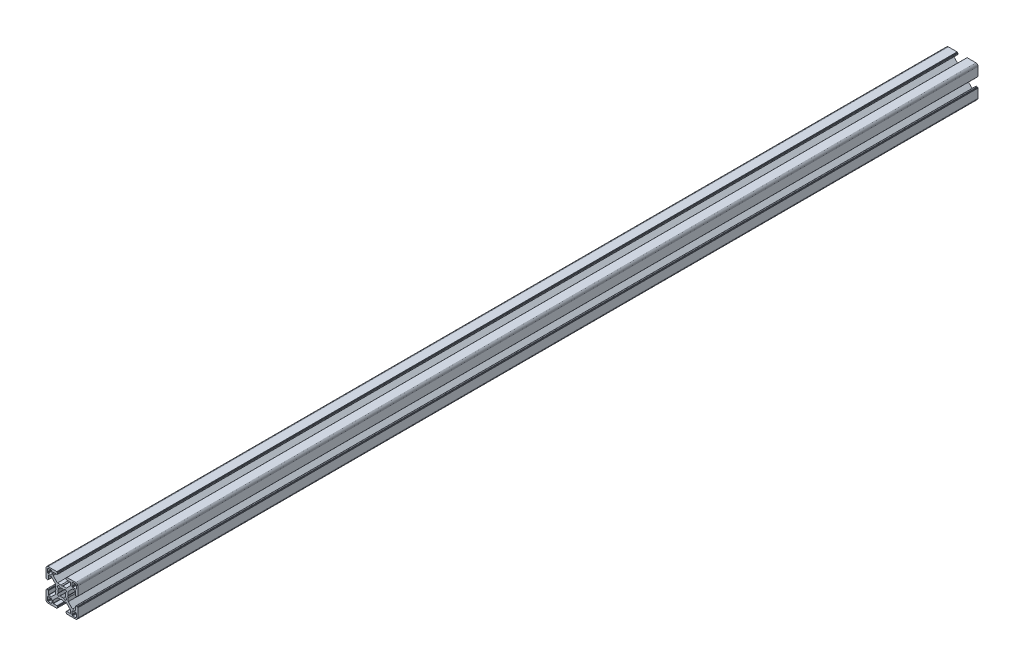
from build123d import *

# Parameters (mm, degrees)
BOSS_EXTRUDE1_DEPTH = 850


with BuildPart() as part:
    # Sketch1 → Boss-Extrude1 (new body)
    with BuildSketch(Plane.XY):
        Polygon((28.34729664, 29.969613999), (28.000000864, 29.999999329), (19.750000909, 29.999999329), (19.715268165, 29.996961355), (19.681595266, 29.987938702), (19.649999216, 29.973205179), (19.621443003, 29.953207821), (19.596790895, 29.928557575), (19.576793537, 29.899999499), (19.562061876, 29.868405312), (19.55303736, 29.834728688), (19.549999386, 29.799999669), (19.549999386, 29.699999839), (19.546961412, 29.665268958), (19.537936896, 29.631596059), (19.523203373, 29.599998146), (19.503207877, 29.571441934), (19.478557631, 29.546789825), (19.449999556, 29.526794329), (19.418403506, 29.512060806), (19.384728745, 29.503038153), (19.349999726, 29.500000179), (19.249999896, 29.500000179), (19.215267517, 29.496958527), (19.181592755, 29.487935874), (19.149996706, 29.47320235), (19.12143863, 29.453206855), (19.096788384, 29.428554746), (19.076791026, 29.399996671), (19.062057503, 29.368402484), (19.05303485, 29.334725859), (19.049996876, 29.299998703), (19.049996876, 28.39999837), (19.059110798, 28.29580945), (19.08618062, 28.194785165), (19.13038119, 28.099997016), (19.190369539, 28.014324653), (19.264324002, 27.94037019), (19.349996366, 27.88038184), (19.444784515, 27.836181271), (19.545806937, 27.809111449), (19.650010894, 27.799984574), (23.050010706, 27.799984574), (23.084741588, 27.7969466), (23.118414487, 27.787923946), (23.150012399, 27.773190423), (23.178568612, 27.753193065), (23.203220721, 27.728542819), (23.223218079, 27.699984744), (23.237949739, 27.668386831), (23.246974255, 27.634713932), (23.25001142, 27.59998608), (23.25001142, 25.049987618), (19.204474482, 20.999982084), (15.900007876, 20.999982084), (15.000008474, 20.48483404), (14.10000814, 20.999982084), (10.795543398, 20.999982084), (7.997342887, 23.801274731), (6.750011387, 25.049984589), (6.750011387, 27.599983051), (6.753049362, 27.634713932), (6.762072946, 27.668386831), (6.776805538, 27.699984744), (6.796801965, 27.728542819), (6.821454073, 27.753193065), (6.850011218, 27.773190423), (6.881607267, 27.787923946), (6.915282029, 27.7969466), (6.950011048, 27.799984574), (10.350011791, 27.799984574), (10.45420071, 27.809098497), (10.555223133, 27.836168318), (10.650011282, 27.880368888), (10.735683645, 27.940357238), (10.809638108, 28.014311701), (10.869626458, 28.099984064), (10.913827027, 28.194772213), (10.940895918, 28.295796498), (10.950010772, 28.399985417), (10.950010772, 29.299985751), (10.946974575, 29.334739239), (10.93795065, 29.368415522), (10.923215933, 29.400009153), (10.903218427, 29.428566473), (10.878566319, 29.45321765), (10.849999264, 29.473204166), (10.818403214, 29.487937689), (10.784728453, 29.496960342), (10.749999434, 29.500000179), (10.649999604, 29.500000179), (10.615270585, 29.503038153), (10.581595823, 29.512060806), (10.549999774, 29.526794329), (10.521441698, 29.546789825), (10.496791452, 29.571441934), (10.476795025, 29.599998146), (10.462061502, 29.631596059), (10.453037918, 29.665268958), (10.449999943, 29.699999839), (10.449999943, 29.799999669), (10.446961969, 29.834728688), (10.437938385, 29.868405312), (10.423205793, 29.899999499), (10.403208435, 29.928557575), (10.378557257, 29.953207821), (10.350000113, 29.973205179), (10.318404064, 29.987938702), (10.284729302, 29.996961355), (10.250000283, 29.999999329), (1.999999397, 29.999999329), (1.652702689, 29.969613999), (1.315958682, 29.879383743), (0.999999233, 29.732050374), (0.714424066, 29.532089829), (0.467910431, 29.285576195), (0.267948955, 28.999999166), (0.120614655, 28.684040532), (0.030384399, 28.34729664), (0, 28.000000864), (0, 19.750000909), (0.003037974, 19.715268165), (0.012061559, 19.681595266), (0.026795082, 19.649999216), (0.046790577, 19.621441141), (0.071442686, 19.596789032), (0.09999983, 19.576793537), (0.13159588, 19.562060013), (0.165270641, 19.55303736), (0.19999966, 19.549999386), (0.299999461, 19.549999386), (0.334728509, 19.546959549), (0.368403242, 19.537936896), (0.399999321, 19.523203373), (0.428556465, 19.503207877), (0.453208573, 19.478555769), (0.473204069, 19.449997693), (0.487937592, 19.418403506), (0.496961176, 19.384728745), (0.499999151, 19.349999726), (0.499999151, 19.249998033), (0.503038056, 19.215269014), (0.512060709, 19.181594253), (0.526794232, 19.150000066), (0.546790194, 19.121441524), (0.571441837, 19.096789882), (0.60000029, 19.076794925), (0.631595686, 19.062061999), (0.665270619, 19.053039982), (0.700000626, 19.050000801), (1.60000096, 19.050000801), (1.704189879, 19.059116587), (1.805213233, 19.086186409), (1.90000045, 19.130385115), (1.985673745, 19.190375328), (2.059627277, 19.264327928), (2.119616325, 19.350002154), (2.163816196, 19.444788441), (2.190886018, 19.545812726), (2.200000872, 19.650001645), (2.200000872, 23.050001457), (2.203039777, 23.084732338), (2.212062431, 23.118405237), (2.226795954, 23.15000315), (2.246792381, 23.178559362), (2.271443558, 23.203211471), (2.300000702, 23.223206967), (2.331596752, 23.23794049), (2.365271513, 23.246965006), (2.400001464, 23.250001117), (4.950000857, 23.250001117), (7.997332093, 20.202670812), (8.995535423, 19.204467788), (8.995535423, 15.900001182), (9.515148227, 15.00000178), (8.995535423, 14.100002378), (8.995535423, 10.795536704), (4.950000857, 6.750002138), (2.400001464, 6.750002138), (2.365271513, 6.753040112), (2.331596752, 6.762063697), (2.300000702, 6.77679722), (2.271443558, 6.796793647), (2.246792381, 6.821444824), (2.226795954, 6.850001968), (2.212062431, 6.881598018), (2.203039777, 6.915272779), (2.200000872, 6.950002729), (2.200000872, 10.350002542), (2.190896812, 10.454174265), (2.16382699, 10.555197618), (2.119627119, 10.649984836), (2.059638071, 10.735658131), (1.985684539, 10.809611663), (1.900011244, 10.869600944), (1.805224027, 10.913800582), (1.704200673, 10.940870404), (1.600011754, 10.949986189), (0.70001142, 10.949986189), (0.665281355, 10.946948596), (0.631606253, 10.937926283), (0.600010578, 10.923193954), (0.571451747, 10.903199537), (0.546799638, 10.87854836), (0.526794232, 10.850000195), (0.512060709, 10.818404146), (0.503038056, 10.784730315), (0.499999151, 10.750000365), (0.499999151, 10.650000535), (0.496961176, 10.615270585), (0.487937592, 10.581596754), (0.473204069, 10.550000705), (0.453208573, 10.521443561), (0.428556465, 10.496791452), (0.399999321, 10.476795956), (0.368403242, 10.462062433), (0.334728509, 10.453038849), (0.299999461, 10.449999943), (0.19999966, 10.449999943), (0.165270641, 10.446961969), (0.13159588, 10.437939316), (0.09999983, 10.423205793), (0.071442686, 10.403209366), (0.046790577, 10.378558189), (0.026795082, 10.350000113), (0.012061559, 10.318404064), (0.003037974, 10.284729302), (0, 10.250000283), (0, 1.999999397), (0.030384399, 1.652702689), (0.120614655, 1.315958682), (0.267948955, 0.999999233), (0.467910431, 0.714424066), (0.714424066, 0.467910431), (0.999999233, 0.267948955), (1.315958682, 0.120614655), (1.652702689, 0.030384399), (1.999999397, 0), (10.250000283, 0), (10.284729302, 0.003037974), (10.318404064, 0.012061559), (10.350000113, 0.026795082), (10.378557257, 0.046790577), (10.403208435, 0.071442686), (10.423205793, 0.09999983), (10.437938385, 0.13159588), (10.446961969, 0.165270641), (10.449999943, 0.19999966), (10.449999943, 0.300000422), (10.453037918, 0.334729441), (10.462061502, 0.368404202), (10.476795025, 0.400000252), (10.496791452, 0.428557396), (10.521441698, 0.453208573), (10.549999774, 0.473205), (10.581595823, 0.487938523), (10.615270585, 0.496961176), (10.649999604, 0.500000082), (10.749999434, 0.500000082), (10.784728453, 0.503038056), (10.818403214, 0.512060709), (10.849999264, 0.526794232), (10.878547894, 0.546800104), (10.903198606, 0.571451747), (10.923194493, 0.6000102), (10.93792742, 0.631606528), (10.946949437, 0.66528146), (10.950010772, 0.699984975), (10.950010772, 1.599985308), (10.940895918, 1.704174228), (10.913827027, 1.805197581), (10.869626458, 1.89998573), (10.809638108, 1.985658094), (10.735683645, 2.059612557), (10.650011282, 2.119600674), (10.555223133, 2.163801476), (10.45420071, 2.190870367), (10.350011791, 2.199985221), (6.950011048, 2.199985221), (6.915282029, 2.203024126), (6.881607267, 2.212046779), (6.850011218, 2.226780302), (6.821454073, 2.246776729), (6.796801965, 2.271427907), (6.776805538, 2.299985982), (6.762072946, 2.331582032), (6.753049362, 2.365256793), (6.750011387, 2.399985812), (6.750011387, 4.949985206), (9.787457566, 7.990785077), (10.795545277, 8.999985833), (14.100010019, 8.999985833), (15.000010353, 9.515133877), (15.900009756, 8.999985833), (19.204476361, 8.999985833), (20.21256413, 7.990786065), (23.25001142, 4.949988235), (23.25001142, 2.399988841), (23.246974255, 2.365256793), (23.237949739, 2.331582032), (23.223218079, 2.299985982), (23.203220721, 2.271427907), (23.178568612, 2.246776729), (23.150012399, 2.226780302), (23.118414487, 2.212046779), (23.084741588, 2.203024126), (23.050010706, 2.199985221), (19.650010894, 2.199985221), (19.545806937, 2.190883319), (19.444784515, 2.163814428), (19.349996366, 2.119613626), (19.264324002, 2.059625509), (19.190369539, 1.985671046), (19.13038119, 1.899998682), (19.08618062, 1.805210533), (19.059110798, 1.70418718), (19.049996876, 1.599998261), (19.049996876, 0.699997927), (19.053035506, 0.665268966), (19.062058795, 0.631594374), (19.076792915, 0.599998603), (19.096790813, 0.571440905), (19.121441524, 0.546790194), (19.149999978, 0.526794306), (19.181596306, 0.51206138), (19.215271238, 0.503039363), (19.249999896, 0.500000082), (19.349999726, 0.500000082), (19.384728745, 0.496961176), (19.418403506, 0.487938523), (19.449999556, 0.473205), (19.478557631, 0.453208573), (19.503207877, 0.428557396), (19.523203373, 0.400000252), (19.537936896, 0.368404202), (19.546961412, 0.334729441), (19.549999386, 0.300000422), (19.549999386, 0.19999966), (19.55303736, 0.165270641), (19.562061876, 0.13159588), (19.576793537, 0.09999983), (19.596789964, 0.071441755), (19.621442072, 0.046789646), (19.649998285, 0.02679415), (19.681594335, 0.012060627), (19.715267234, 0.003037043), (19.750000909, 0), (28.000000864, 0), (28.34729664, 0.030384399), (28.684040532, 0.120614655), (28.999999166, 0.267948955), (29.285576195, 0.467910431), (29.532089829, 0.714424066), (29.732050374, 0.999999233), (29.879383743, 1.315958682), (29.969613999, 1.652702689), (29.999999329, 1.999999397), (29.999999329, 10.250000283), (29.996974806, 10.284715361), (29.987951516, 10.318389952), (29.973217396, 10.349985723), (29.953219499, 10.378543421), (29.928568787, 10.403194133), (29.899999499, 10.423205793), (29.868405312, 10.437939316), (29.834728688, 10.446961969), (29.799999669, 10.449999943), (29.699999839, 10.449999943), (29.664909937, 10.453400043), (29.631233313, 10.462423628), (29.599637263, 10.477157151), (29.57108105, 10.497152646), (29.546427079, 10.521804755), (29.526433446, 10.550361899), (29.511699923, 10.581957949), (29.502675407, 10.615631779), (29.499637433, 10.650361729), (29.499637433, 10.750361559), (29.49697202, 10.784715548), (29.487949367, 10.818389378), (29.473215844, 10.849985428), (29.453220348, 10.878542572), (29.428568239, 10.90319468), (29.400010164, 10.923190176), (29.368415977, 10.937923699), (29.334741215, 10.946947284), (29.300012197, 10.949986189), (28.400011863, 10.949986189), (28.29581215, 10.9408876), (28.194787865, 10.913817778), (28.099999716, 10.86961814), (28.014327352, 10.809628859), (27.940374752, 10.735675327), (27.880384539, 10.650002032), (27.836185833, 10.555214814), (27.809114148, 10.454191461), (27.800000225, 10.350002542), (27.800000225, 6.950002729), (27.796962251, 6.915272779), (27.787939598, 6.881598018), (27.773206075, 6.850001968), (27.753208716, 6.821444824), (27.728558471, 6.796793647), (27.700000395, 6.77679722), (27.668404345, 6.762063697), (27.634729584, 6.753040112), (27.599998702, 6.750002138), (25.05000024, 6.750002138), (23.809199132, 7.99080223), (21.004464477, 10.795534588), (21.004464477, 14.100000262), (20.484851673, 14.999999665), (21.004464477, 15.899999067), (21.004464477, 19.204465672), (25.05000024, 23.250001117), (27.599998702, 23.250001117), (27.634729584, 23.246965006), (27.668404345, 23.23794049), (27.700000395, 23.223206967), (27.728558471, 23.203211471), (27.753208716, 23.178559362), (27.773206075, 23.15000315), (27.787939598, 23.118405237), (27.796962251, 23.084732338), (27.800000225, 23.050001457), (27.800000225, 19.650001645), (27.809114148, 19.545812726), (27.836185833, 19.444788441), (27.880384539, 19.350002154), (27.940370508, 19.264323684), (28.014323108, 19.190371084), (28.099995472, 19.130380872), (28.194783621, 19.086182165), (28.295807906, 19.059112343), (28.400001069, 19.050000801), (29.300001402, 19.050000801), (29.334730421, 19.053040638), (29.368405183, 19.062063291), (29.39999937, 19.076796814), (29.42819671, 19.097149726), (29.452848353, 19.1218023), (29.472843309, 19.150360754), (29.487576235, 19.181955219), (29.496598252, 19.215630151), (29.499637433, 19.250359227), (29.499637433, 19.35036092), (29.502675407, 19.385089939), (29.511699923, 19.4187647), (29.526433446, 19.450358887), (29.546427079, 19.478916963), (29.57108105, 19.503569071), (29.599637263, 19.523564567), (29.631233313, 19.53829809), (29.664909937, 19.547320743), (29.699999839, 19.549999386), (29.799999669, 19.549999386), (29.834728688, 19.55303736), (29.868405312, 19.562060013), (29.899999499, 19.576793537), (29.928557575, 19.596789032), (29.953207821, 19.621441141), (29.973205179, 19.649999216), (29.987938702, 19.681595266), (29.996961355, 19.715268165), (29.999999329, 19.750000909), (29.999999329, 28.000000864), (29.969613999, 28.34729664), (29.879383743, 28.684040532), (29.732050374, 28.999999166), (29.532089829, 29.285576195), (29.285576195, 29.532089829), (28.999999166, 29.732050374), (28.684040532, 29.879383743), align=None)
        Polygon((1.299998723, 25.499999523), (1.299998723, 27.699999511), (1.312309876, 27.856435627), (1.348942518, 28.009016067), (1.408992335, 28.153989464), (1.490981318, 28.287785128), (1.592892222, 28.407108039), (1.71221327, 28.50901708), (1.846008119, 28.591006994), (1.9909814, 28.651056811), (2.143563703, 28.687689453), (2.299998887, 28.699999675), (4.499998875, 28.699999675), (4.656434059, 28.687689453), (4.809016362, 28.651056811), (4.953989759, 28.591006994), (5.087784491, 28.50901708), (5.207106471, 28.407108039), (5.309016444, 28.287785128), (5.391005427, 28.153989464), (5.451056175, 28.009016067), (5.487687886, 27.856435627), (5.499999039, 27.699999511), (5.499999039, 25.499999523), (5.487687886, 25.34356527), (5.451056175, 25.190982968), (5.391005427, 25.04600957), (5.309016444, 24.912213907), (5.207106471, 24.792892858), (5.087784491, 24.690981954), (4.953989759, 24.60899204), (4.809016362, 24.548944086), (4.656434059, 24.512309581), (4.499998875, 24.499999359), (2.299998887, 24.499999359), (2.143563703, 24.512309581), (1.9909814, 24.548944086), (1.846008119, 24.60899204), (1.71221327, 24.690981954), (1.592892222, 24.792892858), (1.490981318, 24.912213907), (1.408992335, 25.04600957), (1.348942518, 25.190982968), (1.312309876, 25.34356527), align=None, mode=Mode.SUBTRACT)
        Polygon((25.34356527, 28.687689453), (25.499999523, 28.699999675), (27.699999511, 28.699999675), (27.856435627, 28.687689453), (28.009017929, 28.651056811), (28.153991327, 28.591006994), (28.28778699, 28.50901708), (28.407108039, 28.407108039), (28.50901708, 28.287785128), (28.591006994, 28.153989464), (28.651056811, 28.009016067), (28.687689453, 27.856435627), (28.700001538, 27.699999511), (28.700001538, 25.499999523), (28.687689453, 25.34356527), (28.651056811, 25.190982968), (28.591006994, 25.04600957), (28.50901708, 24.912213907), (28.407108039, 24.792892858), (28.28778699, 24.690981954), (28.153991327, 24.60899204), (28.009017929, 24.548944086), (27.856435627, 24.512309581), (27.699999511, 24.499999359), (25.499999523, 24.499999359), (25.34356527, 24.512309581), (25.190982968, 24.548944086), (25.04600957, 24.60899204), (24.912215769, 24.690981954), (24.792892858, 24.792892858), (24.690981954, 24.912213907), (24.608993903, 25.04600957), (24.548944086, 25.190982968), (24.512311444, 25.34356527), (24.500001222, 25.499999523), (24.500001222, 27.699999511), (24.512311444, 27.856435627), (24.548944086, 28.009016067), (24.608993903, 28.153989464), (24.690981954, 28.287785128), (24.792892858, 28.407108039), (24.912215769, 28.50901708), (25.04600957, 28.591006994), (25.190982968, 28.651056811), align=None, mode=Mode.SUBTRACT)
        Polygon((14.999999665, 18.649999052), (15.550030395, 18.608318642), (16.087498516, 18.484227359), (16.600128263, 18.280562013), (18.13592948, 19.518401474), (18.644984812, 19.11874488), (19.103571773, 18.662061542), (19.505336881, 18.154669553), (18.280562013, 16.600130126), (18.484227359, 16.087498516), (18.608318642, 15.550030395), (18.649999052, 14.999999665), (18.608318642, 14.449968934), (18.484227359, 13.912500814), (18.280562013, 13.399870135), (19.505336881, 11.845329776), (19.103571773, 11.337937787), (18.644984812, 10.881252587), (18.13592948, 10.481598787), (16.600128263, 11.719437316), (16.087498516, 11.515771039), (15.550030395, 11.391680688), (14.999999665, 11.349999346), (14.449968934, 11.391680688), (13.912500814, 11.515771039), (13.399870135, 11.719437316), (11.864069849, 10.481598787), (11.355013587, 10.881252587), (10.896427557, 11.337937787), (10.494662449, 11.845329776), (11.719438247, 13.399870135), (11.515771039, 13.912500814), (11.391680688, 14.449968934), (11.349999346, 14.999999665), (11.391680688, 15.550030395), (11.515771039, 16.087498516), (11.719438247, 16.600130126), (10.494662449, 18.154669553), (10.896427557, 18.662061542), (11.355013587, 19.11874488), (11.864069849, 19.518401474), (13.399870135, 18.280562013), (13.912500814, 18.484227359), (14.449968934, 18.608318642), align=None, mode=Mode.SUBTRACT)
        Polygon((4.499998875, 1.299999771), (2.299998887, 1.299999771), (2.143563703, 1.312310807), (1.9909814, 1.348942518), (1.846008119, 1.408992335), (1.71221327, 1.490982249), (1.592892222, 1.592892222), (1.490981318, 1.712214202), (1.408992335, 1.846008934), (1.348942518, 1.990982331), (1.312309876, 2.143564634), (1.299998723, 2.299998887), (1.299998723, 4.499999806), (1.312309876, 4.656434059), (1.348942518, 4.809017293), (1.408992335, 4.95399069), (1.490981318, 5.087785423), (1.592892222, 5.207106471), (1.71221327, 5.309017375), (1.846008119, 5.391006358), (1.9909814, 5.451056175), (2.143563703, 5.487688817), (2.299998887, 5.49999997), (4.499998875, 5.49999997), (4.656434059, 5.487688817), (4.809016362, 5.451056175), (4.953989759, 5.391006358), (5.087784491, 5.309017375), (5.207106471, 5.207106471), (5.309016444, 5.087785423), (5.391005427, 4.95399069), (5.451056175, 4.809017293), (5.487687886, 4.656434059), (5.499999039, 4.499999806), (5.499999039, 2.299998887), (5.487687886, 2.143564634), (5.451056175, 1.990982331), (5.391005427, 1.846008934), (5.309016444, 1.712214202), (5.207106471, 1.592892222), (5.087784491, 1.490982249), (4.953989759, 1.408992335), (4.809016362, 1.348942518), (4.656434059, 1.312310807), align=None, mode=Mode.SUBTRACT)
        Polygon((27.699999511, 1.299999771), (25.499999523, 1.299999771), (25.34356527, 1.312310807), (25.190982968, 1.348942518), (25.04600957, 1.408992335), (24.912215769, 1.490982249), (24.792892858, 1.592892222), (24.690981954, 1.712214202), (24.608993903, 1.846008934), (24.548944086, 1.990982331), (24.512311444, 2.143564634), (24.500001222, 2.299998887), (24.500001222, 4.499999806), (24.512311444, 4.656434059), (24.548944086, 4.809017293), (24.608993903, 4.95399069), (24.690981954, 5.087785423), (24.792892858, 5.207106471), (24.912215769, 5.309017375), (25.04600957, 5.391006358), (25.190982968, 5.451056175), (25.34356527, 5.487688817), (25.499999523, 5.49999997), (27.699999511, 5.49999997), (27.856435627, 5.487688817), (28.009017929, 5.451056175), (28.153991327, 5.391006358), (28.28778699, 5.309017375), (28.407108039, 5.207106471), (28.50901708, 5.087785423), (28.591006994, 4.95399069), (28.651056811, 4.809017293), (28.687689453, 4.656434059), (28.700001538, 4.499999806), (28.700001538, 2.299998887), (28.687689453, 2.143564634), (28.651056811, 1.990982331), (28.591006994, 1.846008934), (28.50901708, 1.712214202), (28.407108039, 1.592892222), (28.28778699, 1.490982249), (28.153991327, 1.408992335), (28.009017929, 1.348942518), (27.856435627, 1.312310807), align=None, mode=Mode.SUBTRACT)
    extrude(amount=-BOSS_EXTRUDE1_DEPTH)


solid = part.part
